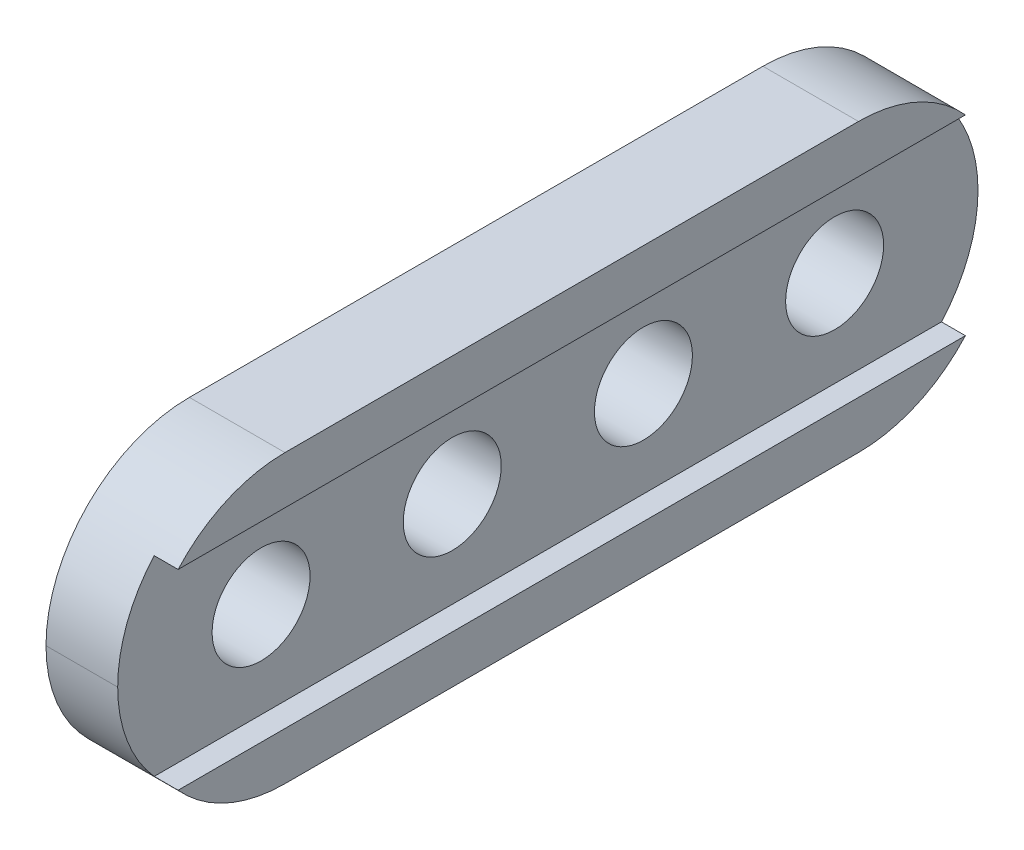
from build123d import *

# Parameters (mm, degrees)
BOSS_EXTRUDE1_DEPTH     = 36
FILLET1_R               = 6
SKETCH2_R               = 2.05
CUT_EXTRUDE1_DEPTH      = 39.157568057
LPATTERN1_COUNT         = 2
LPATTERN1_PITCH         = 8
MIRROR1_COPY_1_SKETCH_R = 2.05
MIRROR1_COPY_1_DEPTH    = 39.157568057


with BuildPart() as part:
    # Sketch1 → Boss-Extrude1 (new body)
    with BuildSketch(Plane.XY):
        Polygon((0, 0), (4, 0), (4, 2), (3, 2), (3, 10), (4, 10), (4, 12), (0, 12), align=None)
    extrude(amount=-BOSS_EXTRUDE1_DEPTH)

    # Fillet1
    fillet1_edges = [part.edges().sort_by_distance(p)[0] for p in [
        (2, 12, 0),
        (2, 0, 0),
        (2, 0, -36),
        (2, 12, -36),
    ]]
    fillet(fillet1_edges, radius=FILLET1_R - 0.0001)  # a hair under: the kernel refuses the full size

    # Sketch2 → Cut-Extrude1 (cut, through all)
    with BuildSketch(Plane.ZY):
        with Locations(Location((-30, 6, 0), (0, 0, 270))):
            Circle(SKETCH2_R)
    cut_extrude1 = extrude(amount=-CUT_EXTRUDE1_DEPTH, mode=Mode.SUBTRACT)

    # LPattern1: Cut-Extrude1 ×2
    with Locations(*[(0, 0, i * LPATTERN1_PITCH) for i in range(1, LPATTERN1_COUNT)]):
        add(cut_extrude1, mode=Mode.SUBTRACT)

    # Mirror1: Cut-Extrude1 across plane
    add(cut_extrude1.mirror(Plane.XY.offset(-18)), mode=Mode.SUBTRACT)

    # Mirror1 copy 1 sketch → Mirror1 copy 1 (cut, through all)
    with BuildSketch(Plane(origin=(0, 0, -44), x_dir=(0, 0, -1), z_dir=(-1, 0, 0))):
        with Locations((-30, -6)):
            Circle(MIRROR1_COPY_1_SKETCH_R)
    extrude(amount=-MIRROR1_COPY_1_DEPTH, mode=Mode.SUBTRACT)


solid = part.part
